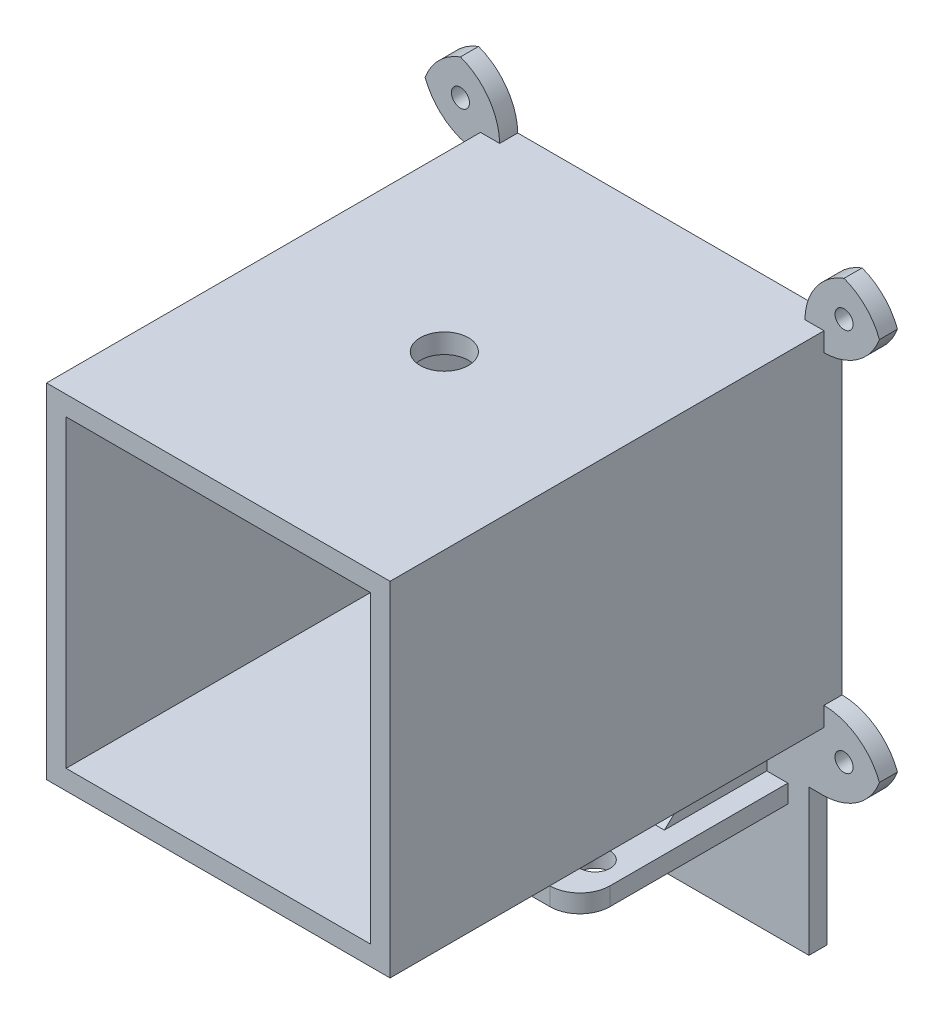
from build123d import *

# Parameters (mm, degrees)
ESQUISSE1_W                  = 57
ESQUISSE1_H                  = 57
ESQUISSE1_W_2                = 50.5
ESQUISSE1_H_2                = 50.5
BOSS_EXTRU_1_DEPTH           = 75
ENL_V_MAT_EXTRU_1_DEPTH      = 99.418748214
ENL_V_MAT_EXTRU_1_DEPTH_BACK = 99.418748214
ESQUISSE2_R                  = 4
ESQUISSE3_W                  = 52
ESQUISSE3_H                  = 34
BOSS_EXTRU_2_DEPTH           = 3
BOSS_EXTRU_3_START           = -23
ESQUISSE4_R                  = 2.5
BOSS_EXTRU_3_DEPTH           = 3
CONG_1_R                     = 5
BOSS_EXTRU_4_START           = -6.5
BOSS_EXTRU_4_DEPTH           = 3
ESQUISSE9_W                  = 13
ESQUISSE9_H                  = 13
ESQUISSE9_R                  = 1.5
BOSS_EXTRU_5_DEPTH           = 3
CONG_2_R                     = 10


with BuildPart() as part:
    # Esquisse1 → Boss.-Extru.1 (new body)
    with BuildSketch(Plane.XY):
        Rectangle(ESQUISSE1_W, ESQUISSE1_H)
        Rectangle(ESQUISSE1_W_2, ESQUISSE1_H_2, mode=Mode.SUBTRACT)
    extrude(amount=BOSS_EXTRU_1_DEPTH)

    # Esquisse2 → Enlèv. mat.-Extru.1 (cut, two sides: drawn at the far end of the back side and taken through both)
    with BuildSketch(Plane.XZ.offset(28.5).offset(-ENL_V_MAT_EXTRU_1_DEPTH_BACK)):
        with Locations(Location((0, 37.5, 0), (0, 0, 270))):
            Circle(ESQUISSE2_R)
    extrude(amount=ENL_V_MAT_EXTRU_1_DEPTH + ENL_V_MAT_EXTRU_1_DEPTH_BACK, mode=Mode.SUBTRACT)

    # Esquisse3 → Boss.-Extru.2 (add)
    with BuildSketch(Plane(origin=(0, 0, 0), x_dir=(-1, 0, 0), z_dir=(0, 0, -1))):
        with Locations((0, -45.5)):
            Rectangle(ESQUISSE3_W, ESQUISSE3_H)
    extrude(amount=-BOSS_EXTRU_2_DEPTH)

    # Esquisse4 → Boss.-Extru.3 (add)
    with BuildSketch(Plane.XZ.offset(62.5).offset(BOSS_EXTRU_3_START)):
        with BuildLine():
            Line((-22.5, 3), (-22.5, 37.5))
            Line((-22.5, 37.5), (-5, 37.5))
            ThreePointArc((-5, 37.5), (0, 32.5), (5, 37.5))
            Line((5, 37.5), (22.5, 37.5))
            Line((22.5, 37.5), (22.5, 3))
            Line((22.5, 3), (-22.5, 3))
        make_face()
        with Locations(Location((-17.5, 30, 0), (0, 0, 270))):
            Circle(ESQUISSE4_R, mode=Mode.SUBTRACT)
        with Locations(Location((17.5, 30, 0), (0, 0, 90))):
            Circle(ESQUISSE4_R, mode=Mode.SUBTRACT)
    extrude(amount=BOSS_EXTRU_3_DEPTH)

    # Congé1
    cong_1_edges = [part.edges().sort_by_distance(p)[0] for p in [
        (-22.5, -41, 37.5),
        (22.5, -41, 37.5),
    ]]
    fillet(cong_1_edges, radius=CONG_1_R)

    # Esquisse8 → Boss.-Extru.4 (add)
    with BuildSketch(Plane.ZY.offset(22.5).offset(BOSS_EXTRU_4_START)):
        Polygon((3, -28.5), (8, -28.5), (20, -39.5), (3, -39.5), align=None)
    boss_extru_4 = extrude(amount=BOSS_EXTRU_4_DEPTH)

    # Symétrie1: Boss.-Extru.4 across plane
    add(boss_extru_4.mirror(Plane(origin=(0, 0, 0), x_dir=(0, 0, 1), z_dir=(1, 0, 0))))

    # Esquisse9 → Boss.-Extru.5 (add)
    # profile 1 of 4: a face of its own
    with BuildSketch(Plane(origin=(0, 0, 0), x_dir=(-1, 0, 0), z_dir=(0, 0, -1))):
        with Locations((-31.819805153, 31.819805153)):
            Rectangle(ESQUISSE9_W, ESQUISSE9_H)
        with Locations((-31.819805153, 31.819805153)):
            Circle(ESQUISSE9_R, mode=Mode.SUBTRACT)
    # profile 2 of 4: a face of its own
    with BuildSketch(Plane(origin=(0, 0, 0), x_dir=(-1, 0, 0), z_dir=(0, 0, -1))):
        with Locations((31.819805153, 31.819805153)):
            Rectangle(ESQUISSE9_W, ESQUISSE9_H)
        with Locations((31.819805153, 31.819805153)):
            Circle(ESQUISSE9_R, mode=Mode.SUBTRACT)
    # profile 3 of 4: a face of its own
    with BuildSketch(Plane(origin=(0, 0, 0), x_dir=(-1, 0, 0), z_dir=(0, 0, -1))):
        with Locations((31.819805153, -31.819805153)):
            Rectangle(ESQUISSE9_W, ESQUISSE9_H)
        with Locations((31.819805153, -31.819805153)):
            Circle(ESQUISSE9_R, mode=Mode.SUBTRACT)
    # profile 4 of 4: a face of its own
    with BuildSketch(Plane(origin=(0, 0, 0), x_dir=(-1, 0, 0), z_dir=(0, 0, -1))):
        with Locations((-31.819805153, -31.819805153)):
            Rectangle(ESQUISSE9_W, ESQUISSE9_H)
        with Locations((-31.819805153, -31.819805153)):
            Circle(ESQUISSE9_R, mode=Mode.SUBTRACT)
    extrude(amount=-BOSS_EXTRU_5_DEPTH)

    # Congé2
    # the kernel refuses this fillet: 10 mm, written as the material it takes off along each edge
    with BuildSketch(Plane(origin=(-38.319805153, -38.319805153, -25), x_dir=(0, 1, 0), z_dir=(0, 0, 1)), Plane(origin=(38.319805153, -38.319805153, -25), x_dir=(-1, 0, 0), z_dir=(0, 0, 1)), Plane(origin=(38.319805153, 38.319805153, -25), x_dir=(0, -1, 0), z_dir=(0, 0, 1)), Plane(origin=(-38.319805153, 38.319805153, -25), x_dir=(1, 0, 0), z_dir=(0, 0, 1))) as cong_2_piece_1:
        with BuildLine():
            CenterArc((CONG_2_R, -CONG_2_R), CONG_2_R, 90, 90)
            Line((0, -CONG_2_R), (-CONG_2_R * 0.02, -CONG_2_R))
            Line((-CONG_2_R * 0.02, -CONG_2_R), (-CONG_2_R * 0.02, CONG_2_R * 0.02))
            Line((-CONG_2_R * 0.02, CONG_2_R * 0.02), (CONG_2_R, CONG_2_R * 0.02))
            Line((CONG_2_R, CONG_2_R * 0.02), (CONG_2_R, 0))
        make_face()
    extrude(amount=53, mode=Mode.SUBTRACT)
    with BuildSketch(Plane(origin=(-38.319805153, -25.319805153, -24.995940898), x_dir=(1, 0, 0), z_dir=(0, 0, 1)), Plane(origin=(38.319805153, 25.319805153, -24.995940898), x_dir=(-1, 0, 0), z_dir=(0, 0, 1)), Plane(origin=(-25.319805153, 38.319805153, -24.995940898), x_dir=(0, -1, 0), z_dir=(0, 0, 1))) as cong_2_piece_2:
        with BuildLine():
            CenterArc((10, -9.998376359), CONG_2_R, 91.032496301, 88.967503699)
            Line((0, -9.998376359), (-0.2, -9.998376359))
            Line((-0.2, -9.998376359), (-0.2, 0))
            Line((-0.2, 0), (0, 0.2))
            ThreePointArc((0, 0.2), (4.909902577, 0.2), (9.816201256, 0.199967527))
            Line((9.816201256, 0.199967527), (9.819805153, 0))
        make_face()
    extrude(amount=52.991881795, mode=Mode.SUBTRACT)
    with BuildSketch(Plane(origin=(38.319805153, -25.319805153, -24.995940898), x_dir=(0, -1, 0), z_dir=(0, 0, 1)), Plane(origin=(25.319805153, 38.319805153, -24.995940898), x_dir=(1, 0, 0), z_dir=(0, 0, 1)), Plane(origin=(-38.319805153, 25.319805153, -24.995940898), x_dir=(0, 1, 0), z_dir=(0, 0, 1))) as cong_2_piece_3:
        with BuildLine():
            CenterArc((9.998376359, -10), CONG_2_R, 90, 88.967503699)
            Line((0, -9.819805153), (-0.199967527, -9.816201256))
            ThreePointArc((-0.199967527, -9.816201256), (-0.2, -4.909902577), (-0.2, 0))
            Line((-0.2, 0), (0, 0.2))
            Line((0, 0.2), (9.998376359, 0.2))
            Line((9.998376359, 0.2), (9.998376359, 0))
        make_face()
    extrude(amount=52.991881795, mode=Mode.SUBTRACT)


solid = part.part
